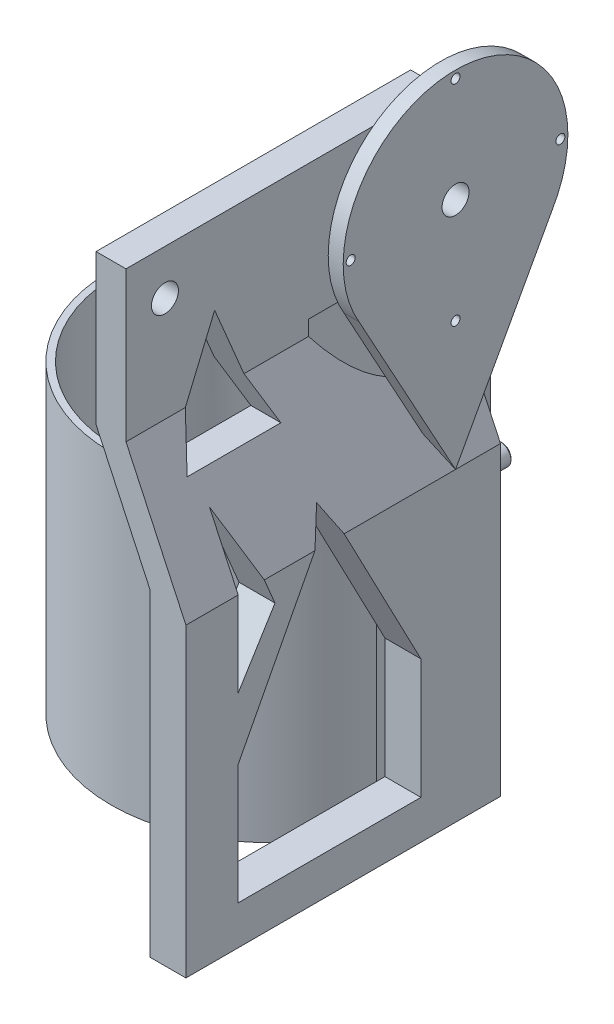
from build123d import *

# Parameters (mm, degrees)
SKETCH1_R                = 52.5
BOSS_EXTRUDE1_DEPTH      = 2
SKETCH2_R                = 52.5
SKETCH2_R_2              = 50.25
BOSS_EXTRUDE2_DEPTH      = 100
BOSS_EXTRUDE3_DEPTH      = 90
BOSS_EXTRUDE3_DEPTH_BACK = 15
BOSS_EXTRUDE4_DEPTH      = 15
BOSS_EXTRUDE4_DEPTH_BACK = 10
SKETCH7_R                = 15
SKETCH8_R                = 37.5
BOSS_EXTRUDE5_DEPTH      = 5
SKETCH9_R                = 1.5
CUT_EXTRUDE1_DEPTH       = 6
CUT_EXTRUDE2_DEPTH       = 265.804278799
CUT_EXTRUDE2_DEPTH_BACK  = 265.804278799
SKETCH5_R                = 4.5
CUT_EXTRUDE3_START       = -4
CUT_EXTRUDE3_DEPTH       = 20
CUT_EXTRUDE4_START       = -3
SKETCH11_W               = 8
SKETCH11_H               = 15
CUT_EXTRUDE4_DEPTH       = 95
SKETCH12_R               = 3
CUT_EXTRUDE5_DEPTH       = 20
SKETCH13_R               = 3.5
SKETCH13_R_2             = 3
BOSS_EXTRUDE6_DEPTH      = 6.5
CHAMFER1_SIZE            = 0.5
SKETCH14_R               = 51.5
CUT_EXTRUDE6_DEPTH       = 48
SKETCH15_R               = 1.5
BOSS_EXTRUDE7_DEPTH      = 5
BOSS_EXTRUDE8_DEPTH      = 5
BOSS_EXTRUDE9_DEPTH      = 6
BOSS_EXTRUDE9_DEPTH_BACK = 6
SKETCH18_W               = 4.388119868
SKETCH18_H               = 39.410417959
SKETCH18_W_2             = 3.988119868
SKETCH18_H_2             = 39.010417959
BOSS_EXTRUDE10_DEPTH     = 148
CUT_EXTRUDE7_DEPTH       = 12
CUT_EXTRUDE8_REACH       = 263.976


with BuildPart() as part:
    # Sketch1 → Boss-Extrude1 (new body)
    with BuildSketch(Plane(origin=(0, 0, 0), x_dir=(1, 0, 0), z_dir=(0, 1, 0))):
        with Locations(Location((0, 0, 0), (0, 0, 270))):
            Circle(SKETCH1_R)
    extrude(amount=BOSS_EXTRUDE1_DEPTH)

    # Sketch2 → Boss-Extrude2 (add)
    with BuildSketch(Plane(origin=(0, 2, 0), x_dir=(1, 0, 0), z_dir=(0, 1, 0))):
        with Locations(Location((0, 0, 0), (0, 0, 270))):
            Circle(SKETCH2_R)
        with Locations(Location((0, 0, 0), (0, 0, 270))):
            Circle(SKETCH2_R_2, mode=Mode.SUBTRACT)
    extrude(amount=BOSS_EXTRUDE2_DEPTH)


with BuildPart() as body_2:
    # Sketch6 → Boss-Extrude3 (new, two sides: drawn at the far end of the back side and taken through both)
    with BuildSketch(Plane.XY.offset(-BOSS_EXTRUDE3_DEPTH_BACK)):
        Polygon((32.5, 195), (32.5, 145), (50.5, 106.3), (50.5, 0), (52.5, 0), (62.5, 0), (62.5, 102), (42.5, 145), (42.5, 195), align=None)
    extrude(amount=BOSS_EXTRUDE3_DEPTH + BOSS_EXTRUDE3_DEPTH_BACK)

    # Sketch7 → Boss-Extrude4 (add, two sides: drawn at the far end of the back side and taken through both)
    with BuildSketch(Plane(origin=(42.5, 0, 0), x_dir=(0, 0, -1), z_dir=(1, 0, 0)).offset(-BOSS_EXTRUDE4_DEPTH_BACK)):
        with Locations(Location((0, 180, 0), (0, 0, 90))):
            Circle(SKETCH7_R)
    extrude(amount=BOSS_EXTRUDE4_DEPTH + BOSS_EXTRUDE4_DEPTH_BACK)

    # Sketch8 → Boss-Extrude5 (add)
    with BuildSketch(Plane(origin=(57.5, 0, 0), x_dir=(0, 0, -1), z_dir=(1, 0, 0))):
        with Locations(Location((0, 180, 0), (0, 0, 90))):
            Circle(SKETCH8_R)
    extrude(amount=BOSS_EXTRUDE5_DEPTH)

    # Sketch9 → Cut-Extrude1 (cut)
    with BuildSketch(Plane(origin=(62.5, 0, 0), x_dir=(0, 0, -1), z_dir=(1, 0, 0))):
        with Locations(Location((-35, 180, 0), (0, 0, 90))):
            Circle(SKETCH9_R)
        with Locations(Location((0, 215, 0), (0, 0, 90))):
            Circle(SKETCH9_R)
        with Locations(Location((35, 180, 0), (0, 0, 90))):
            Circle(SKETCH9_R)
        with Locations(Location((0, 145, 0), (0, 0, 90))):
            Circle(SKETCH9_R)
    extrude(amount=-CUT_EXTRUDE1_DEPTH, mode=Mode.SUBTRACT)

    # Sketch5 → Cut-Extrude2 (cut, two sides: drawn at the far end of the back side and taken through both)
    with BuildSketch(Plane(origin=(68.805630826, 0, 0), x_dir=(0, 0, -1), z_dir=(1, 0, 0)).offset(-CUT_EXTRUDE2_DEPTH_BACK)):
        with Locations(Location((0, 180, 0), (0, 0, 90))):
            Circle(SKETCH5_R)
        with Locations(Location((-77, 180, 0), (0, 0, 90))):
            Circle(SKETCH5_R)
    extrude(amount=CUT_EXTRUDE2_DEPTH + CUT_EXTRUDE2_DEPTH_BACK, mode=Mode.SUBTRACT)


with BuildPart() as cut_extrude3_tool:
    # Sketch10 → Cut-Extrude3 (new body)
    with BuildSketch(Plane(origin=(62.5, 0, 0), x_dir=(0, 0, -1), z_dir=(1, 0, 0)).offset(CUT_EXTRUDE3_START)):
        with BuildLine():
            Line((7.5, 2), (-7.5, 2))
            Line((-7.5, 2), (-7.5, 6))
            ThreePointArc((-7.5, 6), (0, 9.309773059), (7.5, 6))
            Line((7.5, 6), (7.5, 2))
        make_face()
    extrude(amount=-CUT_EXTRUDE3_DEPTH)


with BuildPart() as part_1:
    add(part.part)

    # Cut-Extrude3: cut by cut_extrude3_tool
    add(cut_extrude3_tool.part, mode=Mode.SUBTRACT)



with BuildPart() as body_2_1:
    add(body_2.part)

    # Cut-Extrude3: cut by cut_extrude3_tool
    add(cut_extrude3_tool.part, mode=Mode.SUBTRACT)

    # Sketch11 → Cut-Extrude4 (cut)
    with BuildSketch(Plane.XZ.offset(CUT_EXTRUDE4_START)):
        with Locations((56.5, 0)):
            Rectangle(SKETCH11_W, SKETCH11_H)
    extrude(amount=-CUT_EXTRUDE4_DEPTH, mode=Mode.SUBTRACT)

    # Sketch12 → Cut-Extrude5 (cut)
    with BuildSketch(Plane(origin=(0, 0, -15), x_dir=(-1, 0, 0), z_dir=(0, 0, -1))):
        with Locations((-56.5, 93)):
            Circle(SKETCH12_R)
    extrude(amount=-CUT_EXTRUDE5_DEPTH, mode=Mode.SUBTRACT)

    # Sketch13 → Boss-Extrude6 (add)
    with BuildSketch(Plane(origin=(0, 0, -15), x_dir=(-1, 0, 0), z_dir=(0, 0, -1))):
        with Locations(Location((-56.5, 93, 0), (0, 0, 180))):
            Circle(SKETCH13_R)
        with Locations((-56.5, 93)):
            Circle(SKETCH13_R_2, mode=Mode.SUBTRACT)
    extrude(amount=BOSS_EXTRUDE6_DEPTH)

    # Chamfer1
    chamfer1_edges = [body_2_1.edges().sort_by_distance(p)[0] for p in [
        (53, 93, -21.5),
    ]]
    chamfer(chamfer1_edges, length=CHAMFER1_SIZE - 0.0001)  # a hair under: the kernel refuses the full size

    # Sketch14 → Cut-Extrude6 (cut)
    with BuildSketch(Plane(origin=(0, 102, 0), x_dir=(1, 0, 0), z_dir=(0, 1, 0))):
        Circle(SKETCH14_R)
    extrude(amount=CUT_EXTRUDE6_DEPTH, mode=Mode.SUBTRACT)

    # Sketch15 → Boss-Extrude7 (add)
    with BuildSketch(Plane(origin=(62.5, 0, 0), x_dir=(0, 0, -1), z_dir=(1, 0, 0))):
        Polygon((-33.512753614, 163.173076775), (0, 102), (33.512753614, 163.173076775), align=None)
        with Locations(Location((0, 145, 0), (0, 0, 90))):
            Circle(SKETCH15_R, mode=Mode.SUBTRACT)
    extrude(amount=-BOSS_EXTRUDE7_DEPTH)

    # Sketch16 → Boss-Extrude8 (add)
    with BuildSketch(Plane.ZY.offset(-57.5)):
        Polygon((-11.8572367, 170.812729576), (-3.863517383, 104.969648), (3.542835396, 104.969648), (11.646025701, 170.546424731), align=None)
    extrude(amount=BOSS_EXTRUDE8_DEPTH)

    # Sketch17 → Boss-Extrude9 (add, two sides: drawn at the far end of the back side and taken through both)
    with BuildSketch(Plane.XY.offset(-BOSS_EXTRUDE9_DEPTH_BACK)):
        Polygon((44.979042662, 173.247563953), (44.979042662, 165.800390699), (53.161932833, 150.308684598), (53.161932833, 173.247563953), align=None)
    extrude(amount=BOSS_EXTRUDE9_DEPTH + BOSS_EXTRUDE9_DEPTH_BACK)


with BuildPart() as part_2:
    add(part_1.part)

    add(body_2_1.part)  # Boss-Extrude10 merges body 2
    # Sketch18 → Boss-Extrude10 (add)
    with BuildSketch(Plane(origin=(0, 2, 0), x_dir=(1, 0, 0), z_dir=(0, 1, 0))):
        with Locations((37.256595202, -8.286604054)):
            Rectangle(SKETCH18_W, SKETCH18_H)
        with Locations((37.256595202, -8.286604053)):
            Rectangle(SKETCH18_W_2, SKETCH18_H_2, mode=Mode.SUBTRACT)
    extrude(amount=BOSS_EXTRUDE10_DEPTH)

    # Sketch19 → Cut-Extrude7 (cut)
    with BuildSketch(Plane(origin=(62.5, 0, 0), x_dir=(0, 0, -1), z_dir=(1, 0, 0))):
        Polygon((-72.544377907, 13.00185454), (-11.567320289, 13.00185454), (-11.567320289, 53.055277221), (-42.055849098, 111.310144767), (-72.544377907, 53.055277221), align=None)
        Polygon((-76.052706901, 131.115597336), (-44.770106705, 131.115597336), (-60.411406803, 168.245412522), align=None)
        Polygon((-72.544377907, 73.680676562), (-72.544377907, 122.667191379), (-60.262958239, 93.513167119), align=None)
    extrude(amount=-CUT_EXTRUDE7_DEPTH, mode=Mode.SUBTRACT)

    # Cut-Extrude8: up to this face of the body (flat: up to its plane)
    cut_extrude8_end = Plane(part_2.part.faces().sort_by_distance((42.166193849, 124.217683224, 58.964397348))[0])
    # Sketch19<2> → Cut-Extrude8 (cut, up to the picked face)
    with BuildSketch(Plane(origin=(62.5, 0, 0), x_dir=(0, 0, -1), z_dir=(1, 0, 0)), mode=Mode.PRIVATE) as cut_extrude8_sk1:
        Polygon((-72.544377907, 13.00185454), (-11.567320289, 13.00185454), (-11.567320289, 53.055277221), (-42.055849098, 111.310144767), (-72.544377907, 53.055277221), align=None)
    cut_extrude8_tool1 = split(extrude(cut_extrude8_sk1.sketch, amount=-CUT_EXTRUDE8_REACH, mode=Mode.PRIVATE), bisect_by=cut_extrude8_end, keep=Keep.BOTH, mode=Mode.PRIVATE)
    # Sketch19<2> → Cut-Extrude8 (cut, up to the picked face)
    with BuildSketch(Plane(origin=(62.5, 0, 0), x_dir=(0, 0, -1), z_dir=(1, 0, 0)), mode=Mode.PRIVATE) as cut_extrude8_sk2:
        Polygon((-76.052706901, 131.115597336), (-44.770106705, 131.115597336), (-60.411406803, 168.245412522), align=None)
    cut_extrude8_tool2 = split(extrude(cut_extrude8_sk2.sketch, amount=-CUT_EXTRUDE8_REACH, mode=Mode.PRIVATE), bisect_by=cut_extrude8_end, keep=Keep.BOTH, mode=Mode.PRIVATE)
    # Sketch19<2> → Cut-Extrude8 (cut, up to the picked face)
    with BuildSketch(Plane(origin=(62.5, 0, 0), x_dir=(0, 0, -1), z_dir=(1, 0, 0)), mode=Mode.PRIVATE) as cut_extrude8_sk3:
        Polygon((-72.544377907, 73.680676562), (-72.544377907, 122.667191379), (-60.262958239, 93.513167119), align=None)
    cut_extrude8_tool3 = split(extrude(cut_extrude8_sk3.sketch, amount=-CUT_EXTRUDE8_REACH, mode=Mode.PRIVATE), bisect_by=cut_extrude8_end, keep=Keep.BOTH, mode=Mode.PRIVATE)
    add(cut_extrude8_tool1.solids().sort_by(Axis((62.5, 49.636219, 42.055849), (-1, 0, 0)))[0], mode=Mode.SUBTRACT)
    add(cut_extrude8_tool2.solids().sort_by(Axis((62.5, 143.492202, 60.411407), (-1, 0, 0)))[0], mode=Mode.SUBTRACT)
    add(cut_extrude8_tool3.solids().sort_by(Axis((62.5, 96.620345, 68.450571), (-1, 0, 0)))[0], mode=Mode.SUBTRACT)


solid = part_2.part
